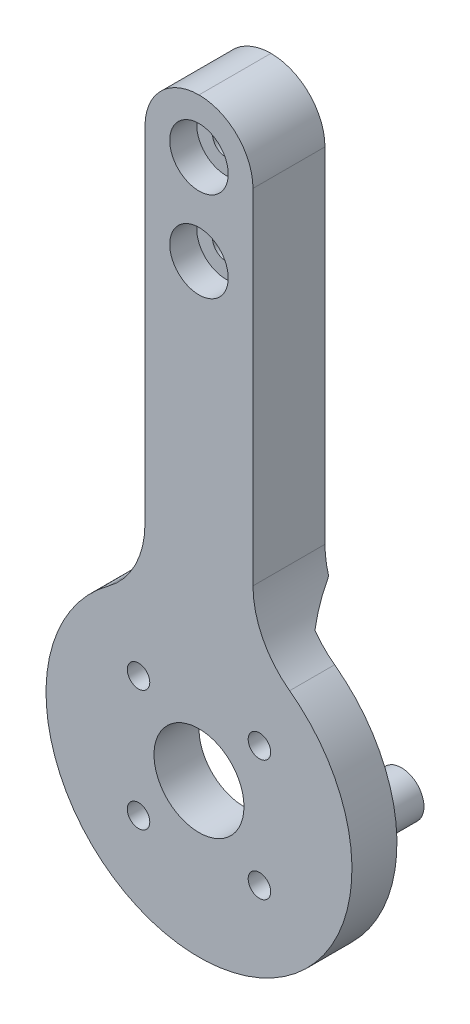
from build123d import *
from build123d.topology import SkipClean

# Parameters (mm, degrees)
SCHIZZO1_R                   = 1.5
SCHIZZO1_R_2                 = 1.25
SCHIZZO1_R_3                 = 5
ESTRUSIONE_ESTRUSIONE1_DEPTH = 5
ESTRUSIONE_ESTRUSIONE2_START = 3
SCHIZZO2_W                   = 12
SCHIZZO2_H                   = 50.094026279
SCHIZZO2_R                   = 1.5
ESTRUSIONE_ESTRUSIONE2_DEPTH = 3
SMUSSO1_SIZE                 = 3
SMUSSO2_SIZE                 = 1.5
RACCORDO1_R                  = 10
RACCORDO2_R                  = 6
SCHIZZO3_R                   = 3.25
TAGLIO_ESTRUSIONE1_DEPTH     = 3
SCHIZZO6_R                   = 2.5
SCHIZZO6_R_2                 = 1.15
ESTRUSIONE_ESTRUSIONE4_DEPTH = 5
SMUSSO5_SIZE                 = 1.5


# Some blends are built 0.0001 mm under size
with BuildPart() as part:
    # Schizzo1 → Estrusione-Estrusione1 (new body)
    with BuildSketch(Plane.XY):
        with BuildLine():
            Line((-6, -44.094026279), (-6, 6))
            Line((-6, 6), (6, 6))
            Line((6, 6), (6, -44.094026279))
            ThreePointArc((6, -44.094026279), (0, -77), (-6, -44.094026279))
        make_face()
        Circle(SCHIZZO1_R, mode=Mode.SUBTRACT)
        with Locations((0, -10)):
            Circle(SCHIZZO1_R, mode=Mode.SUBTRACT)
        with Locations((6.717514421, -53.282485579)):
            Circle(SCHIZZO1_R_2, mode=Mode.SUBTRACT)
        with Locations((6.717514421, -66.717514421)):
            Circle(SCHIZZO1_R_2, mode=Mode.SUBTRACT)
        with Locations((-6.717514421, -66.717514421)):
            Circle(SCHIZZO1_R_2, mode=Mode.SUBTRACT)
        with Locations((-6.717514421, -53.282485579)):
            Circle(SCHIZZO1_R_2, mode=Mode.SUBTRACT)
        with Locations((0, -60)):
            Circle(SCHIZZO1_R_3, mode=Mode.SUBTRACT)
    extrude(amount=ESTRUSIONE_ESTRUSIONE1_DEPTH)

    # Schizzo2 → Estrusione-Estrusione2 (add)
    with SkipClean():  # the faces are left unmerged after this step: merging them gives an invalid solid
        with BuildSketch(Plane(origin=(0, 0, 0), x_dir=(-1, 0, 0), z_dir=(0, 0, -1)).offset(ESTRUSIONE_ESTRUSIONE2_START)):
            with Locations((0, -19.04701314)):
                Rectangle(SCHIZZO2_W, SCHIZZO2_H)
            with Locations((0, -10)):
                Circle(SCHIZZO2_R, mode=Mode.SUBTRACT)
            Circle(SCHIZZO2_R, mode=Mode.SUBTRACT)
        extrude(amount=-ESTRUSIONE_ESTRUSIONE2_DEPTH)

    # Smusso1
    smusso1_edges = [part.edges().sort_by_distance(p)[0] for p in [
        (0, -44.094026279, -3),
    ]]
    chamfer(smusso1_edges, length=SMUSSO1_SIZE - 0.0001)  # a hair under: the kernel refuses the full size

    # Smusso2
    smusso2_edges = [part.edges().sort_by_distance(p)[0] for p in [
        (5.467514421, -53.282485579, 0),
        (5.467514421, -66.717514421, 0),
        (-7.967514421, -66.717514421, 0),
        (-7.967514421, -53.282485579, 0),
    ]]
    chamfer(smusso2_edges, length=SMUSSO2_SIZE)

    # Raccordo1
    # the kernel refuses this fillet: 10 mm, written as the material it adds along each edge
    with BuildSketch(Plane(origin=(-6, -44.094026279, 0), x_dir=(-0.8787816347081872, -0.47722409672983424, 0), z_dir=(0, 0, 1))) as raccordo1_piece_1_section:
        with BuildLine():
            CenterArc((5.999591874, -9.906601275), RACCORDO1_R, 97.8369433, 53.658796906)
            Line((-2.788224473, -5.134360308), (0, 0))
            ThreePointArc((0, 0), (2.318024133, -0.158777832), (4.636048266, 0))
        make_face()
    raccordo1_piece_1 = extrude(amount=5, mode=Mode.PRIVATE)
    raccordo1_piece_1 = split(raccordo1_piece_1, bisect_by=Plane(origin=(-8.522721578, -45.012190054, 0.918063775), z_dir=(0, -0.7071067811865479, -0.7071067811865471)), keep=Keep.TOP, mode=Mode.PRIVATE)
    add(raccordo1_piece_1)
    with BuildSketch(Plane(origin=(-6, -44.094026279, -14.606473626), x_dir=(-0.878781634708187, -0.4772240967298343, 0), z_dir=(0, 0, 1))) as raccordo1_piece_2_section:
        with BuildLine():
            CenterArc((5.999591874, -9.906601275), RACCORDO1_R, 97.8369433, 53.658796906)
            Line((-2.788224473, -5.134360308), (0, 0))
            ThreePointArc((0, 0), (2.318024133, -0.158777832), (4.636048266, 0))
        make_face()
    raccordo1_piece_2 = extrude(amount=19.606473626, mode=Mode.PRIVATE)
    raccordo1_piece_2 = split(raccordo1_piece_2, bisect_by=Plane(origin=(-6.210339147, -41.400349773, 0), z_dir=(0, 0, -1)), keep=Keep.TOP, mode=Mode.PRIVATE)
    raccordo1_piece_2 = split(raccordo1_piece_2, bisect_by=Plane(origin=(-6.210339147, -41.400349773, -3), z_dir=(0, 0, 1)), keep=Keep.TOP, mode=Mode.PRIVATE)
    raccordo1_piece_2 = split(raccordo1_piece_2, bisect_by=Plane(origin=(-6.210339147, -42.183942817, -1.910183463), z_dir=(0, 0.7071067811865479, 0.7071067811865471)), keep=Keep.TOP, mode=Mode.PRIVATE)
    add(raccordo1_piece_2)
    with BuildSketch(Plane(origin=(-6, -44.094026279, 0), x_dir=(-0.8787816347081872, -0.47722409672983424, 0), z_dir=(0, 0, 1))) as raccordo1_piece_3_section:
        with BuildLine():
            CenterArc((5.999591874, -9.906601275), RACCORDO1_R, 97.8369433, 53.658796906)
            Line((-2.788224473, -5.134360308), (0, 0))
            ThreePointArc((0, 0), (2.318024133, -0.158777832), (4.636048266, 0))
        make_face()
    raccordo1_piece_3 = extrude(amount=5, mode=Mode.PRIVATE)
    raccordo1_piece_3 = split(raccordo1_piece_3, bisect_by=Plane(origin=(-7.748442969, -44.094026279, 2.842039125), z_dir=(0, -1, 0)), keep=Keep.TOP, mode=Mode.PRIVATE)
    raccordo1_piece_3 = split(raccordo1_piece_3, bisect_by=Plane(origin=(-7.748442969, -45.857184965, 1.763058685), z_dir=(0, 0.7071067811865479, 0.7071067811865471)), keep=Keep.TOP, mode=Mode.PRIVATE)
    add(raccordo1_piece_3)
    with BuildSketch(Plane(origin=(-6, -44.094026279, 0), x_dir=(-0.8787816347081872, -0.47722409672983424, 0), z_dir=(0, 0, 1))) as raccordo1_piece_4_section:
        with BuildLine():
            CenterArc((5.999591874, -9.906601275), RACCORDO1_R, 97.8369433, 53.658796906)
            Line((-2.788224473, -5.134360308), (0, 0))
            ThreePointArc((0, 0), (2.318024133, -0.158777832), (4.636048266, 0))
        make_face()
    raccordo1_piece_4 = extrude(amount=5, mode=Mode.PRIVATE)
    raccordo1_piece_4 = split(raccordo1_piece_4, bisect_by=Plane(origin=(-6.391601074, -44.094026279, 2.5), z_dir=(0, 1, 0)), keep=Keep.TOP, mode=Mode.PRIVATE)
    add(raccordo1_piece_4)
    with BuildSketch(Plane(origin=(6, -44.094026279, 0), x_dir=(0.8787816347081857, -0.4772240967298369, 0), z_dir=(0, 0, 1))) as raccordo1_piece_5_section:
        with BuildLine():
            CenterArc((5.999591874, 9.906601275), RACCORDO1_R, 208.504259794, 53.658796906)
            Line((-2.788224473, 5.134360308), (0, 0))
            ThreePointArc((0, 0), (2.318024133, 0.158777832), (4.636048266, 0))
        make_face()
    raccordo1_piece_5 = extrude(amount=5, mode=Mode.PRIVATE)
    raccordo1_piece_5 = split(raccordo1_piece_5, bisect_by=Plane(origin=(8.522721578, -45.012190054, 0.918063775), z_dir=(0, -0.7071067811865479, -0.7071067811865471)), keep=Keep.TOP, mode=Mode.PRIVATE)
    add(raccordo1_piece_5)
    with BuildSketch(Plane(origin=(6, -44.094026279, -14.606473626), x_dir=(0.8787816347081857, -0.4772240967298369, 0), z_dir=(0, 0, 1))) as raccordo1_piece_6_section:
        with BuildLine():
            CenterArc((5.999591874, 9.906601275), RACCORDO1_R, 208.504259794, 53.658796906)
            Line((-2.788224473, 5.134360308), (0, 0))
            ThreePointArc((0, 0), (2.318024133, 0.158777832), (4.636048266, 0))
        make_face()
    raccordo1_piece_6 = extrude(amount=19.606473626, mode=Mode.PRIVATE)
    raccordo1_piece_6 = split(raccordo1_piece_6, bisect_by=Plane(origin=(6.210339147, -41.400349773, 0), z_dir=(0, 0, -1)), keep=Keep.TOP, mode=Mode.PRIVATE)
    raccordo1_piece_6 = split(raccordo1_piece_6, bisect_by=Plane(origin=(6.210339147, -42.183942817, -1.910183463), z_dir=(0, 0.7071067811865479, 0.7071067811865471)), keep=Keep.TOP, mode=Mode.PRIVATE)
    raccordo1_piece_6 = split(raccordo1_piece_6, bisect_by=Plane(origin=(6.210339147, -41.400349773, -3), z_dir=(0, 0, 1)), keep=Keep.TOP, mode=Mode.PRIVATE)
    add(raccordo1_piece_6)
    with BuildSketch(Plane(origin=(6, -44.094026279, 0), x_dir=(0.8787816347081857, -0.4772240967298369, 0), z_dir=(0, 0, 1))) as raccordo1_piece_7_section:
        with BuildLine():
            CenterArc((5.999591874, 9.906601275), RACCORDO1_R, 208.504259794, 53.658796906)
            Line((-2.788224473, 5.134360308), (0, 0))
            ThreePointArc((0, 0), (2.318024133, 0.158777832), (4.636048266, 0))
        make_face()
    raccordo1_piece_7 = extrude(amount=5, mode=Mode.PRIVATE)
    raccordo1_piece_7 = split(raccordo1_piece_7, bisect_by=Plane(origin=(7.748442969, -44.094026279, 2.842039125), z_dir=(0, -1, 0)), keep=Keep.TOP, mode=Mode.PRIVATE)
    raccordo1_piece_7 = split(raccordo1_piece_7, bisect_by=Plane(origin=(7.748442969, -45.857184965, 1.763058685), z_dir=(0, 0.7071067811865479, 0.7071067811865471)), keep=Keep.TOP, mode=Mode.PRIVATE)
    add(raccordo1_piece_7)
    with BuildSketch(Plane(origin=(6, -44.094026279, 0), x_dir=(0.8787816347081857, -0.4772240967298369, 0), z_dir=(0, 0, 1))) as raccordo1_piece_8_section:
        with BuildLine():
            CenterArc((5.999591874, 9.906601275), RACCORDO1_R, 208.504259794, 53.658796906)
            Line((-2.788224473, 5.134360308), (0, 0))
            ThreePointArc((0, 0), (2.318024133, 0.158777832), (4.636048266, 0))
        make_face()
    raccordo1_piece_8 = extrude(amount=5, mode=Mode.PRIVATE)
    raccordo1_piece_8 = split(raccordo1_piece_8, bisect_by=Plane(origin=(6.391601074, -44.094026279, 2.5), z_dir=(0, 1, 0)), keep=Keep.TOP, mode=Mode.PRIVATE)
    add(raccordo1_piece_8)

    # Raccordo2
    raccordo2_edges = [part.edges().sort_by_distance(p)[0] for p in [
        (-6, 6, 1),
        (6, 6, 1),
    ]]
    fillet(raccordo2_edges, radius=RACCORDO2_R - 0.0001)  # a hair under: the kernel refuses the full size

    # Schizzo3 → Taglio-Estrusione1 (cut)
    with BuildSketch(Plane.XY.offset(5)):
        Circle(SCHIZZO3_R)
        with Locations((0, -10)):
            Circle(SCHIZZO3_R)
    extrude(amount=-TAGLIO_ESTRUSIONE1_DEPTH, mode=Mode.SUBTRACT)

    # Schizzo6 → Estrusione-Estrusione4 (add)
    # profile 1 of 4: a face of its own
    with BuildSketch(Plane(origin=(0, 0, 0), x_dir=(-1, 0, 0), z_dir=(0, 0, -1))):
        with Locations(Location((0, -47.5, 0), (0, 0, 180))):
            Circle(SCHIZZO6_R)
        with Locations((0, -47.5)):
            Circle(SCHIZZO6_R_2, mode=Mode.SUBTRACT)
    # profile 2 of 4: a face of its own
    with BuildSketch(Plane(origin=(0, 0, 0), x_dir=(-1, 0, 0), z_dir=(0, 0, -1))):
        with Locations(Location((12.5, -60, 0), (0, 0, 180))):
            Circle(SCHIZZO6_R)
        with Locations((12.5, -60)):
            Circle(SCHIZZO6_R_2, mode=Mode.SUBTRACT)
    # profile 3 of 4: a face of its own
    with BuildSketch(Plane(origin=(0, 0, 0), x_dir=(-1, 0, 0), z_dir=(0, 0, -1))):
        with Locations(Location((0, -72.5, 0), (0, 0, 180))):
            Circle(SCHIZZO6_R)
        with Locations((0, -72.5)):
            Circle(SCHIZZO6_R_2, mode=Mode.SUBTRACT)
    # profile 4 of 4: a face of its own
    with BuildSketch(Plane(origin=(0, 0, 0), x_dir=(-1, 0, 0), z_dir=(0, 0, -1))):
        with Locations(Location((-12.5, -60, 0), (0, 0, 180))):
            Circle(SCHIZZO6_R)
        with Locations((-12.5, -60)):
            Circle(SCHIZZO6_R_2, mode=Mode.SUBTRACT)
    extrude(amount=ESTRUSIONE_ESTRUSIONE4_DEPTH)

    # Smusso5
    # the kernel refuses this chamfer: 1.5 mm, written as the material it adds along each edge
    with BuildSketch(Plane(origin=(0, -47.5, 0), x_dir=(1, 0, 0), z_dir=(0, 1, 0))) as smusso5_piece_1:
        Polygon((2.5 + SMUSSO5_SIZE, 0), (2.5, SMUSSO5_SIZE), (2.5, 0), align=None)
    revolve(axis=Axis((0, -47.5, 0), (0, 0, -1)))
    with BuildSketch(Plane(origin=(-12.5, -60, 0), x_dir=(1, 0, 0), z_dir=(0, 1, 0))) as smusso5_piece_2:
        Polygon((2.5 + SMUSSO5_SIZE, 0), (2.5, SMUSSO5_SIZE), (2.5, 0), align=None)
    revolve(axis=Axis((-12.5, -60, 0), (0, 0, -1)))
    with BuildSketch(Plane(origin=(0, -72.5, 0), x_dir=(1, 0, 0), z_dir=(0, 1, 0))) as smusso5_piece_3:
        Polygon((2.5 + SMUSSO5_SIZE, 0), (2.5, SMUSSO5_SIZE), (2.5, 0), align=None)
    revolve(axis=Axis((0, -72.5, 0), (0, 0, -1)))
    with BuildSketch(Plane(origin=(12.5, -60, 0), x_dir=(1, 0, 0), z_dir=(0, 1, 0))) as smusso5_piece_4:
        Polygon((2.5 + SMUSSO5_SIZE, 0), (2.5, SMUSSO5_SIZE), (2.5, 0), align=None)
    revolve(axis=Axis((12.5, -60, 0), (0, 0, -1)))


solid = part.part
